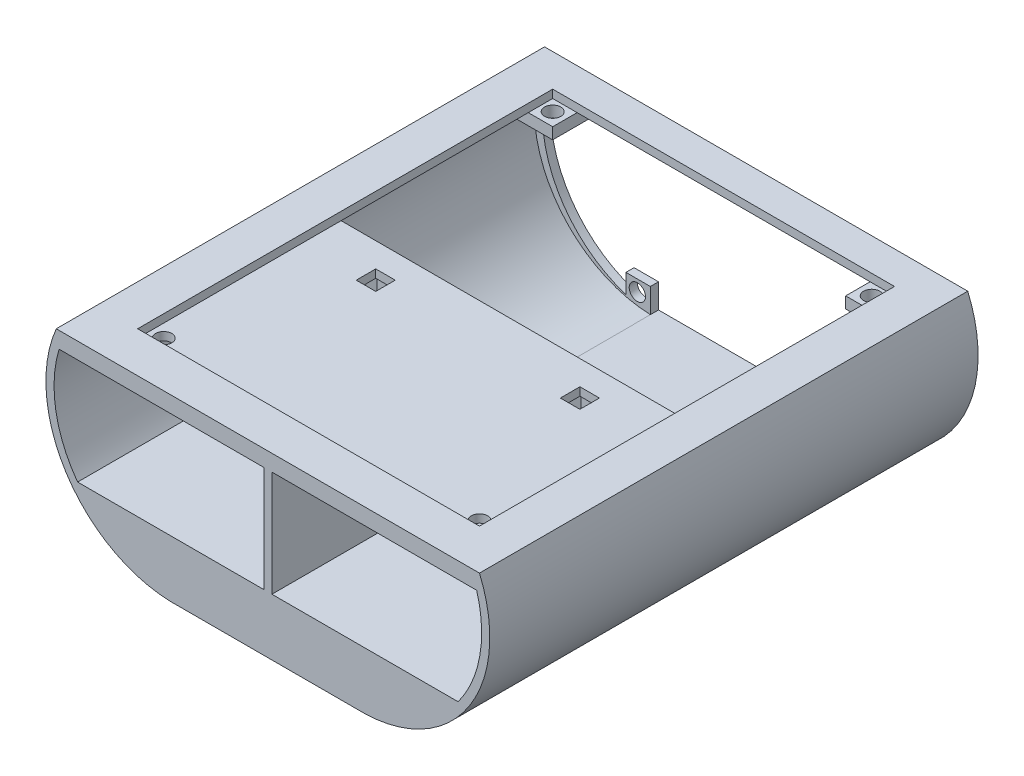
from build123d import *

# Parameters (mm, degrees)
SALIENTE_EXTRUIR1_DEPTH = 300
VACIADO1_START          = 47.215476502
VACIADO1_DEPTH          = 295
CROQUIS3_R              = 7.5
CROQUIS3_R_2            = 10
CROQUIS3_W              = 35.4
CROQUIS3_H              = 33.7
CORTAR_EXTRUIR1_DEPTH   = 15
SALIENTE_EXTRUIR2_START = -150
SALIENTE_EXTRUIR2_DEPTH = 150
VACIADO3_START          = 197.215476502
VACIADO3_DEPTH          = 145
CROQUIS5_W              = 5
CROQUIS5_H              = 70
SALIENTE_EXTRUIR3_DEPTH = 145
CROQUIS6_R              = 12.5
CORTAR_EXTRUIR2_DEPTH   = 15
CROQUIS7_W              = 210
CROQUIS7_H              = 255
CORTAR_EXTRUIR3_DEPTH   = 5
SALIENTE_EXTRUIR4_DEPTH = 70
SALIENTE_EXTRUIR5_START = -150
SALIENTE_EXTRUIR5_DEPTH = 150
CORTAR_EXTRUIR6_START   = -150
CORTAR_EXTRUIR6_DEPTH   = 150
CORTAR_EXTRUIR7_START   = -150
CORTAR_EXTRUIR7_DEPTH   = 150
CORTAR_EXTRUIR9_DEPTH   = 15
CROQUIS19_R             = 5
CORTAR_EXTRUIR10_DEPTH  = 15
SALIENTE_EXTRUIR6_START = -5
SALIENTE_EXTRUIR6_DEPTH = 5
CROQUIS21_W             = 25
CROQUIS21_H             = 25
CROQUIS21_R             = 5
SALIENTE_EXTRUIR7_DEPTH = 7
CROQUIS22_R             = 5
CORTAR_EXTRUIR13_DEPTH  = 7
CROQUIS23_W             = 26
CROQUIS23_H             = 24
CROQUIS23_H_2           = 35
CROQUIS23_W_2           = 24
SALIENTE_EXTRUIR8_DEPTH = 20
CROQUIS24_W             = 12
CROQUIS24_H             = 12
CORTAR_EXTRUIR14_DEPTH  = 20


# Read off the part's stored shape, not the designer's step: Vaciado1, Vaciado3
with BuildPart() as part:
    # Croquis2 → Saliente-Extruir1 (new body)
    with BuildSketch(Plane.XY.offset(42.215476502)):
        with BuildLine():
            Line((-130, 55), (130, 55))
            ThreePointArc((130, 55), (124.004556318, -18.45744493), (60, -55))
            Line((60, -55), (-60, -55))
            ThreePointArc((-60, -55), (-124.004556318, -18.45744493), (-130, 55))
        make_face()
    extrude(amount=SALIENTE_EXTRUIR1_DEPTH)

    # Vaciado1 outline → Vaciado1 (cut)
    with BuildSketch(Plane.XY.offset(VACIADO1_START)):
        with BuildLine():
            ThreePointArc((-126.620697254, 50), (-118.915904499, -17.108764781), (-59.914914782, -50))
            Line((-59.914914782, -50), (59.914914782, -50))
            ThreePointArc((59.914914782, -50), (118.915904499, -17.108764781), (126.620697254, 50))
            Line((126.620697254, 50), (-126.620697254, 50))
        make_face()
    extrude(amount=VACIADO1_DEPTH, mode=Mode.SUBTRACT)

    # Croquis3 → Cortar-Extruir1 (cut)
    with BuildSketch(Plane(origin=(0, -55, 0), x_dir=(-1, 0, 0), z_dir=(0, -1, 0))):
        with Locations(Location((30, -178.515476502, 0), (0, 0, 180))):
            Circle(CROQUIS3_R)
        with Locations(Location((0, -178.515476502, 0), (0, 0, 180))):
            Circle(CROQUIS3_R)
        with Locations(Location((-30, -178.515476502, 0), (0, 0, 180))):
            Circle(CROQUIS3_R)
        with Locations(Location((0, -138.515476502, 0), (0, 0, 180))):
            Circle(CROQUIS3_R_2)
        with Locations((0, -225.365476502)):
            Rectangle(CROQUIS3_W, CROQUIS3_H)
    extrude(amount=-CORTAR_EXTRUIR1_DEPTH, mode=Mode.SUBTRACT)

    # Croquis4 → Saliente-Extruir2 (add)
    with BuildSketch(Plane.XY.offset(342.215476502).offset(SALIENTE_EXTRUIR2_START)):
        with BuildLine():
            Line((0, -25), (-112.847078194, -25))
            ThreePointArc((-112.847078194, -25), (-130.13811515, 10.589281798), (-126.620697254, 50))
            Line((-126.620697254, 50), (0, 50))
            Line((0, 50), (126.620697254, 50))
            ThreePointArc((126.620697254, 50), (130.13811515, 10.589281798), (112.847078194, -25))
            Line((112.847078194, -25), (0, -25))
        make_face()
    extrude(amount=SALIENTE_EXTRUIR2_DEPTH)

    # Vaciado3 outline → Vaciado3 (cut)
    with BuildSketch(Plane.XY.offset(VACIADO3_START)):
        with BuildLine():
            Line((126.620697254, 50), (-126.620697254, 50))
            ThreePointArc((-126.620697254, 50), (-130.649934486, 13.762761692), (-116.885919238, -20))
            Line((-116.885919238, -20), (116.885919238, -20))
            ThreePointArc((116.885919238, -20), (130.649934486, 13.762761692), (126.620697254, 50))
        make_face()
    extrude(amount=VACIADO3_DEPTH, mode=Mode.SUBTRACT)

    # Croquis5 → Saliente-Extruir3 (add)
    with BuildSketch(Plane.XY.offset(197.215476502)):
        with Locations((0, 15)):
            Rectangle(CROQUIS5_W, CROQUIS5_H)
    extrude(amount=SALIENTE_EXTRUIR3_DEPTH)

    # Croquis6 → Cortar-Extruir2 (cut)
    with BuildSketch(Plane.XY.offset(197.215476502)):
        with Locations((-62.5, 15)):
            Circle(CROQUIS6_R)
        with Locations((62.5, 15)):
            Circle(CROQUIS6_R)
    extrude(amount=-CORTAR_EXTRUIR2_DEPTH, mode=Mode.SUBTRACT)

    # Croquis7 → Cortar-Extruir3 (cut)
    with BuildSketch(Plane(origin=(0, 55, 0), x_dir=(1, 0, 0), z_dir=(0, 1, 0))):
        with Locations((0, -189.715476502)):
            Rectangle(CROQUIS7_W, CROQUIS7_H)
    extrude(amount=-CORTAR_EXTRUIR3_DEPTH, mode=Mode.SUBTRACT)

    # Croquis8 → Saliente-Extruir4 (add)
    with BuildSketch(Plane(origin=(0, 50, 0), x_dir=(1, 0, 0), z_dir=(0, 1, 0))):
        Polygon((47.439003576, -197.215476502), (2.5, -233.652506429), (2.5, -227.215476502), (39.5, -197.215476502), align=None)
        Polygon((78, -197.215476502), (130, -233.301491229), (130, -227.215476502), (86.769956122, -197.215476502), align=None)
        Polygon((-2.5, -233.652506429), (-47.439003576, -197.215476502), (-39.5, -197.215476502), (-2.5, -227.215476502), align=None)
        Polygon((-78, -197.215476502), (-130, -232.215476502), (-130, -226.188386524), (-86.954533682, -197.215476502), align=None)
    extrude(amount=-SALIENTE_EXTRUIR4_DEPTH)

    # Croquis10 → Saliente-Extruir5 (add)
    with BuildSketch(Plane.XY.offset(342.215476502).offset(SALIENTE_EXTRUIR5_START)):
        with BuildLine():
            Line((-2.5, 45), (-2.5, 50))
            Line((-2.5, 50), (-126.620697254, 50))
            ThreePointArc((-126.620697254, 50), (-127.504866775, 47.514965781), (-128.299912644, 45))
            Line((-128.299912644, 45), (-126.620697254, 45))
            Line((-126.620697254, 45), (-2.5, 45))
        make_face()
        with BuildLine():
            ThreePointArc((128.299912644, 45), (127.504866775, 47.514965781), (126.620697254, 50))
            Line((126.620697254, 50), (2.5, 50))
            Line((2.5, 50), (2.5, 45))
            Line((2.5, 45), (128.299912644, 45))
        make_face()
    extrude(amount=SALIENTE_EXTRUIR5_DEPTH)

    # Croquis13 → Cortar-Extruir6 (cut)
    with BuildSketch(Plane.XY.offset(342.215476502).offset(CORTAR_EXTRUIR6_START)):
        with BuildLine():
            Line((-130, -7.088562093), (-130, -20))
            Line((-130, -20), (-122.997470988, -20))
            ThreePointArc((-122.997470988, -20), (-126.799457266, -13.707377748), (-130, -7.088562093))
        make_face()
    extrude(amount=CORTAR_EXTRUIR6_DEPTH, mode=Mode.SUBTRACT)

    # Croquis14 → Cortar-Extruir7 (cut)
    with BuildSketch(Plane.XY.offset(342.215476502).offset(CORTAR_EXTRUIR7_START)):
        with BuildLine():
            Line((130, -7.088562093), (130, -20))
            Line((130, -20), (122.997470988, -20))
            ThreePointArc((122.997470988, -20), (126.799457266, -13.707377748), (130, -7.088562093))
        make_face()
    extrude(amount=CORTAR_EXTRUIR7_DEPTH, mode=Mode.SUBTRACT)

    # Croquis18 → Cortar-Extruir9 (cut)
    with BuildSketch(Plane(origin=(0, 0, 42.215476502), x_dir=(-1, 0, 0), z_dir=(0, 0, -1))):
        with BuildLine():
            Line((-106.50023103, 50), (106.50023103, 50))
            Line((106.50023103, 50), (106.50023103, 35))
            Line((106.50023103, 35), (125.485042145, 35))
            ThreePointArc((125.485042145, 35), (115.350222936, -15.242927128), (75, -46.848714508))
            Line((75, -46.848714508), (75, -35))
            Line((75, -35), (60, -35))
            Line((60, -35), (60, -50))
            Line((60, -50), (-60, -50))
            Line((-60, -50), (-60, -35))
            Line((-60, -35), (-75, -35))
            Line((-75, -35), (-75, -46.848714508))
            ThreePointArc((-75, -46.848714508), (-115.350222936, -15.242927128), (-125.485042145, 35))
            Line((-125.485042145, 35), (-106.50023103, 35))
            Line((-106.50023103, 35), (-106.50023103, 50))
        make_face()
    extrude(amount=-CORTAR_EXTRUIR9_DEPTH, mode=Mode.SUBTRACT)

    # Croquis19 → Cortar-Extruir10 (cut)
    with BuildSketch(Plane(origin=(0, 0, 42.215476502), x_dir=(-1, 0, 0), z_dir=(0, 0, -1))):
        with Locations((-113.50023103, 42)):
            Circle(CROQUIS19_R)
        with Locations((113.50023103, 42)):
            Circle(CROQUIS19_R)
        with Locations((68, -42)):
            Circle(CROQUIS19_R)
        with Locations((-68, -42)):
            Circle(CROQUIS19_R)
    extrude(amount=-CORTAR_EXTRUIR10_DEPTH, mode=Mode.SUBTRACT)

    # Croquis20 → Saliente-Extruir6 (add)
    with BuildSketch(Plane.XY.offset(342.215476502).offset(SALIENTE_EXTRUIR6_START)):
        with BuildLine():
            Line((112.847078194, -25), (-112.847078194, -25))
            ThreePointArc((-112.847078194, -25), (-88.958164591, -42.956603327), (-59.914914782, -50))
            Line((-59.914914782, -50), (59.914914782, -50))
            ThreePointArc((59.914914782, -50), (88.958164591, -42.956603327), (112.847078194, -25))
        make_face()
    extrude(amount=SALIENTE_EXTRUIR6_DEPTH)

    # Croquis21 → Saliente-Extruir7 (add)
    # profile 1 of 2: a face of its own
    with BuildSketch(Plane(origin=(0, 50, 0), x_dir=(-1, 0, 0), z_dir=(0, -1, 0))):
        with Locations((-102.5, -64.715476502)):
            Rectangle(CROQUIS21_W, CROQUIS21_H)
        with Locations(Location((-98, -69.215476502, 0), (0, 0, 180))):
            Circle(CROQUIS21_R, mode=Mode.SUBTRACT)
    # profile 2 of 2: a face of its own
    with BuildSketch(Plane(origin=(0, 50, 0), x_dir=(-1, 0, 0), z_dir=(0, -1, 0))):
        with Locations((102.5, -64.715476502)):
            Rectangle(CROQUIS21_W, CROQUIS21_H)
        with Locations(Location((98, -69.215476502, 0), (0, 0, 180))):
            Circle(CROQUIS21_R, mode=Mode.SUBTRACT)
    extrude(amount=SALIENTE_EXTRUIR7_DEPTH)

    # Croquis22 → Cortar-Extruir13 (cut)
    with BuildSketch(Plane(origin=(0, 50, 0), x_dir=(1, 0, 0), z_dir=(0, 1, 0))):
        with Locations(Location((-97, -309.215476502, 0), (0, 0, 180))):
            Circle(CROQUIS22_R)
        with Locations(Location((97, -309.215476502, 0), (0, 0, 180))):
            Circle(CROQUIS22_R)
    extrude(amount=-CORTAR_EXTRUIR13_DEPTH, mode=Mode.SUBTRACT)

    # Croquis23 → Saliente-Extruir8 (add)
    with BuildSketch(Plane(origin=(0, -50, 0), x_dir=(1, 0, 0), z_dir=(0, 1, 0))):
        Polygon((18, -161.515476502), (18, -121.515476502), (-17, -121.515476502), (-17, -161.515476502), (-47, -161.515476502), (-47, -195.515476502), (47, -195.515476502), (47, -161.515476502), align=None)
        with Locations((29, -178.515476502)):
            Rectangle(CROQUIS23_W, CROQUIS23_H, mode=Mode.SUBTRACT)
        with Locations((-29, -178.515476502)):
            Rectangle(CROQUIS23_W, CROQUIS23_H, mode=Mode.SUBTRACT)
        with Locations((0, -144.015476502)):
            Rectangle(CROQUIS23_W, CROQUIS23_H_2, mode=Mode.SUBTRACT)
        with Locations((0, -178.515476502)):
            Rectangle(CROQUIS23_W_2, CROQUIS23_H, mode=Mode.SUBTRACT)
    extrude(amount=SALIENTE_EXTRUIR8_DEPTH)

    # Croquis24 → Cortar-Extruir14 (cut)
    with BuildSketch(Plane(origin=(0, 50, 0), x_dir=(1, 0, 0), z_dir=(0, 1, 0))):
        with Locations((62.719501788, -213.215476502)):
            Rectangle(CROQUIS24_W, CROQUIS24_H)
        with Locations((-62.719501788, -213.215476502)):
            Rectangle(CROQUIS24_W, CROQUIS24_H)
    extrude(amount=-CORTAR_EXTRUIR14_DEPTH, mode=Mode.SUBTRACT)


solid = part.part
